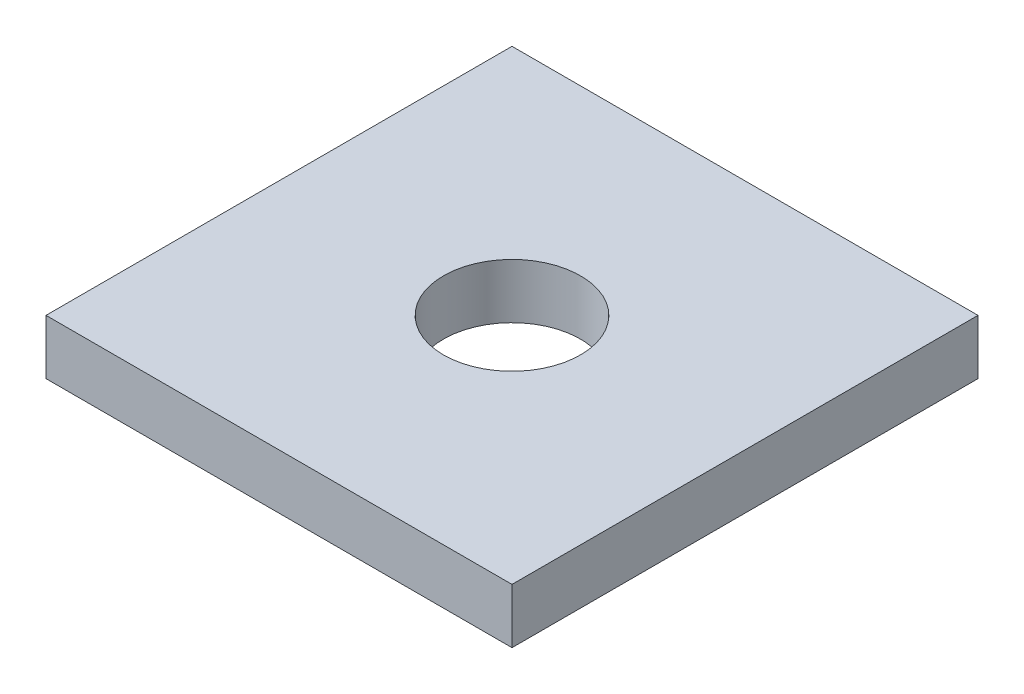
from build123d import *

# Parameters (mm, degrees)
SKETCH1_W          = 340
SKETCH1_H          = 340
BASE_DEPTH         = 40
SKETCH2_R          = 50
ACTUATOR_CUT_DEPTH = 40


with BuildPart() as part:
    # Sketch1 → base (new body)
    with BuildSketch(Plane(origin=(0, 0, 0), x_dir=(1, 0, 0), z_dir=(0, 1, 0))):
        Rectangle(SKETCH1_W, SKETCH1_H)
    extrude(amount=BASE_DEPTH)

    # Sketch2 → actuator cut (cut)
    with BuildSketch(Plane(origin=(0, 40, 0), x_dir=(1, 0, 0), z_dir=(0, 1, 0))):
        Circle(SKETCH2_R)
    extrude(amount=-ACTUATOR_CUT_DEPTH, mode=Mode.SUBTRACT)


solid = part.part
